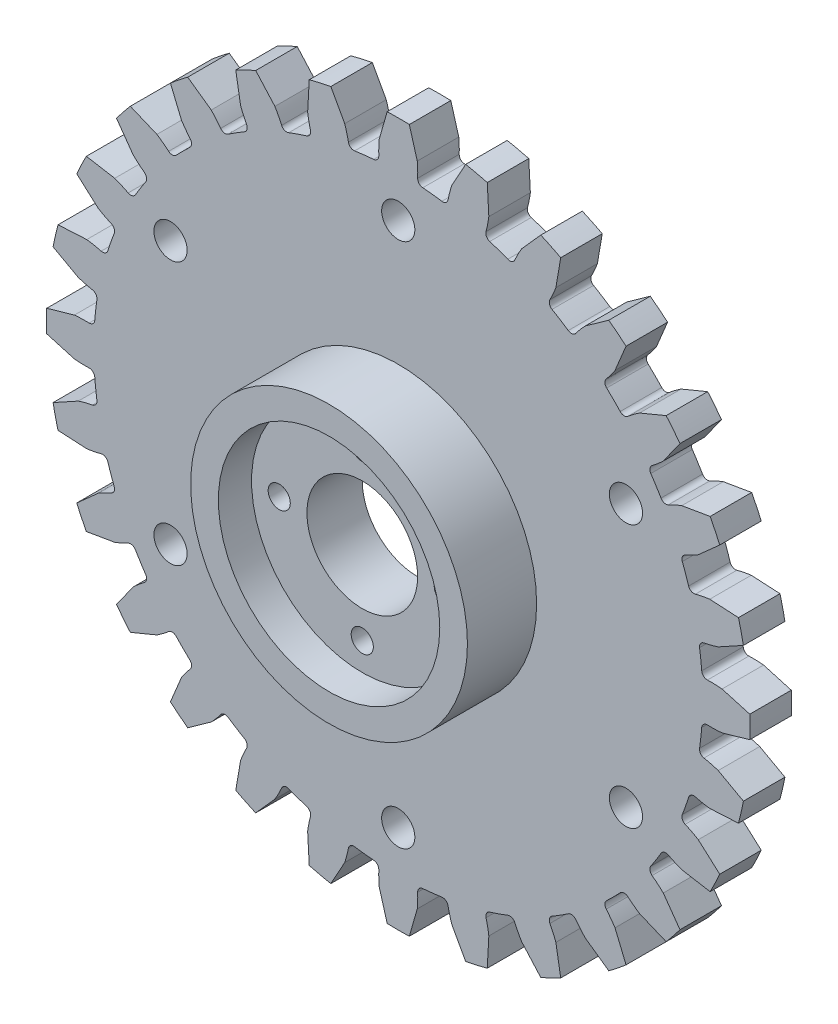
from build123d import *

# Parameters (mm, degrees)
SKETCH2_R                  = 110
BOSS_EXTRUDE1_DEPTH        = 15
BOSS_EXTRUDE2_START        = -15
BOSS_EXTRUDE2_DEPTH        = 15
FILLET1_R                  = 2
CIRPATTERN1_COUNT          = 28
FILLET1_OF_CIRPATTERN1_R   = 2
F_12_0_12_DIAMETER_HOLE1_D = 12
SKETCH7_R                  = 50
SKETCH7_R_2                = 40
BOSS_EXTRUDE3_DEPTH        = 25
SKETCH8_R                  = 20
CUT_EXTRUDE1_DEPTH         = 182.424915739
SKETCH9_R                  = 40
CUT_EXTRUDE2_DEPTH         = 8
F_8_0_8_DIAMETER_HOLE1_D   = 8
BOSS_EXTRUDE4_START        = 13
SKETCH12_R                 = 40
SKETCH12_R_2               = 4
SKETCH12_R_3               = 20
BOSS_EXTRUDE4_DEPTH        = 13


with BuildPart() as part:
    # Sketch2 → Boss-Extrude1 (new body)
    with BuildSketch(Plane.XY):
        Circle(SKETCH2_R)
    extrude(amount=BOSS_EXTRUDE1_DEPTH)

    # Sketch4 → Boss-Extrude2 (add)
    with BuildSketch(Plane.XY.offset(15).offset(BOSS_EXTRUDE2_START)):
        with BuildLine():
            Line((-4, 127), (-6.867453858, 117))
            ThreePointArc((-6.867453858, 117), (-7.051123324, 113.392144113), (-6.924467086, 109.781837093))
            ThreePointArc((-6.924467086, 109.781837093), (0, 110), (6.924467086, 109.781837093))
            ThreePointArc((6.924467086, 109.781837093), (7.051123324, 113.392144113), (6.867453858, 117))
            Line((6.867453858, 117), (4, 127))
            ThreePointArc((4, 127), (0, 127.062976512), (-4, 127))
        make_face()
    boss_extrude2 = extrude(amount=BOSS_EXTRUDE2_DEPTH)

    # Fillet1
    fillet1_edges = [part.edges().sort_by_distance(p)[0] for p in [
        (6.924467086, 109.781837093, 7.5),
        (-6.924467086, 109.781837093, 7.5),
    ]]
    fillet(fillet1_edges, radius=FILLET1_R)

    # CirPattern1: Boss-Extrude2 ×28 about axis
    cirpattern1_axis = Axis((0, 0, 0), (0, 0, 1))
    for i in range(1, CIRPATTERN1_COUNT):
        add(boss_extrude2.rotate(cirpattern1_axis, i * 360 / CIRPATTERN1_COUNT))

    # Fillet1 of CirPattern1
    fillet1_of_cirpattern1_edges = [part.edges().sort_by_distance(p)[0] for p in [
        (-17.677900682, 108.570216116, 7.5),
        (-31.179613161, 105.48853835, 7.5),
        (-41.393824694, 101.914431153, 7.5),
        (-53.871283237, 95.905603811, 7.5),
        (-63.03408949, 90.148231054, 7.5),
        (-73.861622224, 81.513561831, 7.5),
        (-81.513561831, 73.861622224, 7.5),
        (-90.148231054, 63.03408949, 7.5),
        (-95.905603811, 53.871283237, 7.5),
        (-101.914431153, 41.393824694, 7.5),
        (-105.48853835, 31.179613161, 7.5),
        (-108.570216116, 17.677900682, 7.5),
        (-109.781837093, 6.924467086, 7.5),
        (-109.781837093, -6.924467086, 7.5),
        (-108.570216116, -17.677900682, 7.5),
        (-105.48853835, -31.179613161, 7.5),
        (-101.914431153, -41.393824694, 7.5),
        (-95.905603811, -53.871283237, 7.5),
        (-90.148231054, -63.03408949, 7.5),
        (-81.513561831, -73.861622224, 7.5),
        (-73.861622224, -81.513561831, 7.5),
        (-63.03408949, -90.148231054, 7.5),
        (-53.871283237, -95.905603811, 7.5),
        (-41.393824694, -101.914431153, 7.5),
        (-31.179613161, -105.48853835, 7.5),
        (-17.677900682, -108.570216116, 7.5),
        (-6.924467086, -109.781837093, 7.5),
        (6.924467086, -109.781837093, 7.5),
        (17.677900682, -108.570216116, 7.5),
        (31.179613161, -105.48853835, 7.5),
        (41.393824694, -101.914431153, 7.5),
        (53.871283237, -95.905603811, 7.5),
        (63.03408949, -90.148231054, 7.5),
        (73.861622224, -81.513561831, 7.5),
        (81.513561831, -73.861622224, 7.5),
        (90.148231054, -63.03408949, 7.5),
        (95.905603811, -53.871283237, 7.5),
        (101.914431153, -41.393824694, 7.5),
        (105.48853835, -31.179613161, 7.5),
        (108.570216116, -17.677900682, 7.5),
        (109.781837093, -6.924467086, 7.5),
        (109.781837093, 6.924467086, 7.5),
        (108.570216116, 17.677900682, 7.5),
        (105.48853835, 31.179613161, 7.5),
        (101.914431153, 41.393824694, 7.5),
        (95.905603811, 53.871283237, 7.5),
        (90.148231054, 63.03408949, 7.5),
        (81.513561831, 73.861622224, 7.5),
        (73.861622224, 81.513561831, 7.5),
        (63.03408949, 90.148231054, 7.5),
        (53.871283237, 95.905603811, 7.5),
        (41.393824694, 101.914431153, 7.5),
        (31.179613161, 105.48853835, 7.5),
        (17.677900682, 108.570216116, 7.5),
    ]]
    fillet(fillet1_of_cirpattern1_edges, radius=FILLET1_OF_CIRPATTERN1_R)

    # Ø12.0 (12) Diameter Hole1 (through all)
    with Locations(Plane.XY.offset(15)):
        with Locations((-82.27241336, 47.5), (0, 95), (82.27241336, 47.5), (82.27241336, -47.5), (0, -95), (-82.27241336, -47.5)):
            Hole(F_12_0_12_DIAMETER_HOLE1_D / 2)

    # Sketch7 → Boss-Extrude3 (add)
    with BuildSketch(Plane.XY.offset(15)):
        Circle(SKETCH7_R)
        Circle(SKETCH7_R_2, mode=Mode.SUBTRACT)
    extrude(amount=BOSS_EXTRUDE3_DEPTH)

    # Sketch8 → Cut-Extrude1 (cut, through all)
    with BuildSketch(Plane.XY.offset(15)):
        Circle(SKETCH8_R)
    extrude(amount=-CUT_EXTRUDE1_DEPTH, mode=Mode.SUBTRACT)

    # Sketch9 → Cut-Extrude2 (cut)
    with BuildSketch(Plane(origin=(0, 0, 0), x_dir=(-1, 0, 0), z_dir=(0, 0, -1))):
        with Locations(Location((0, 0, 0), (0, 0, 180))):
            Circle(SKETCH9_R)
    extrude(amount=-CUT_EXTRUDE2_DEPTH, mode=Mode.SUBTRACT)

    # Ø8.0 (8) Diameter Hole1 (through all)
    with Locations(Plane(origin=(0, 0, 8), x_dir=(-1, 0, 0), z_dir=(0, 0, -1))):
        with Locations((-30, 0), (0, 30), (30, 0), (0, -30)):
            Hole(F_8_0_8_DIAMETER_HOLE1_D / 2)

    # Sketch12 → Boss-Extrude4 (add)
    with BuildSketch(Plane.XY.offset(15).offset(BOSS_EXTRUDE4_START)):
        Circle(SKETCH12_R)
        with Locations(Location((30, 0, 0), (0, 0, 180))):
            Circle(SKETCH12_R_2, mode=Mode.SUBTRACT)
        Circle(SKETCH12_R_3, mode=Mode.SUBTRACT)
        with Locations(Location((0, -30, 0), (0, 0, 180))):
            Circle(SKETCH12_R_2, mode=Mode.SUBTRACT)
        with Locations(Location((-30, 0, 0), (0, 0, 180))):
            Circle(SKETCH12_R_2, mode=Mode.SUBTRACT)
        with Locations(Location((0, 30, 0), (0, 0, 180))):
            Circle(SKETCH12_R_2, mode=Mode.SUBTRACT)
    extrude(amount=-BOSS_EXTRUDE4_DEPTH)


solid = part.part
